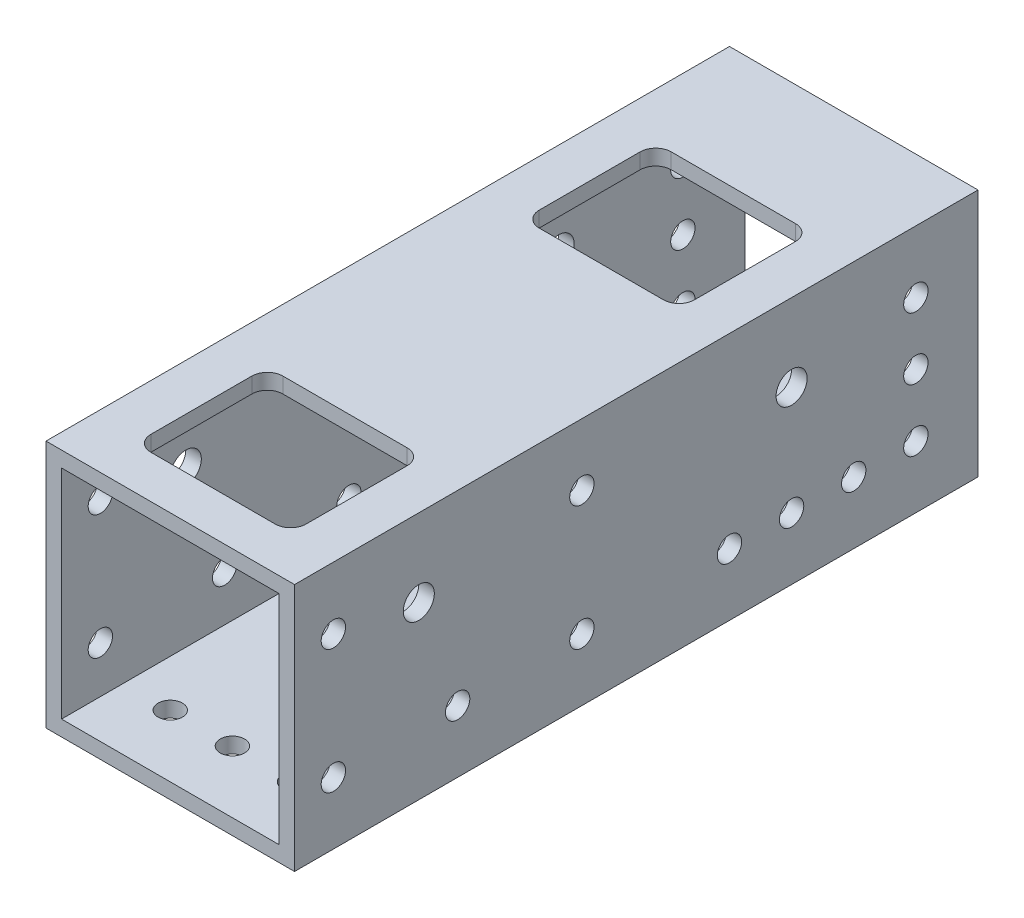
from build123d import *

# Parameters (mm, degrees)
SKETCH1_W               = 50.8
SKETCH1_H               = 50.8
BOSS_EXTRUDE1_DEPTH     = 69.85
SHELL1_T                = -3.175
SKETCH2_W               = 31.75
SKETCH2_H               = 26.9875
CUT_EXTRUDE1_DEPTH      = 79.545162168
FILLET1_R               = 3.175
CUT_EXTRUDE2_DEPTH      = 79.545162168
CUT_EXTRUDE2_DEPTH_BACK = 79.545162168
SKETCH3_R               = 3.175
CUT_EXTRUDE3_DEPTH      = 79.545162168
CUT_EXTRUDE3_DEPTH_BACK = 79.545162168
SKETCH4_R               = 2.4892
CUT_EXTRUDE4_DEPTH      = 79.545162168
CUT_EXTRUDE4_DEPTH_BACK = 79.545162168
SKETCH5_R               = 2.4892
FILLET2_R               = 3.175


with BuildPart() as part:
    # Sketch1 → Boss-Extrude1 (new, symmetric)
    with BuildSketch(Plane.XY):
        Rectangle(SKETCH1_W, SKETCH1_H)
    extrude(amount=BOSS_EXTRUDE1_DEPTH, both=True)

    # Shell1
    shell1_openings = [part.faces().sort_by_distance(p)[0] for p in [
        (0, 0, -69.85),
        (0, 0, 69.85),
    ]]
    offset(amount=SHELL1_T, openings=shell1_openings, kind=Kind.INTERSECTION)

    # Sketch2 → Cut-Extrude1 (cut, through all)
    with BuildSketch(Plane(origin=(0, 0, 0), x_dir=(1, 0, 0), z_dir=(0, 1, 0))):
        with Locations((0, 31.75)):
            Rectangle(SKETCH2_W, SKETCH2_H)
        with Locations((0, -47.625)):
            Rectangle(SKETCH2_W, SKETCH2_H)
    extrude(amount=CUT_EXTRUDE1_DEPTH, mode=Mode.SUBTRACT)

    # Fillet1
    fillet1_edges = [part.edges().sort_by_distance(p)[0] for p in [
        (15.875, 23.8125, -45.24375),
        (-15.875, 23.8125, -45.24375),
        (-15.875, 23.8125, -18.25625),
        (15.875, 23.8125, -18.25625),
    ]]
    fillet(fillet1_edges, radius=FILLET1_R)

    # Sketch3 → Cut-Extrude2 (cut, two sides: drawn at the far end of the back side and taken through both)
    with BuildSketch(Plane(origin=(0, 0, 0), x_dir=(0, 0, -1), z_dir=(1, 0, 0)).offset(-CUT_EXTRUDE2_DEPTH_BACK)):
        with Locations((31.75, 9.525)):
            Circle(SKETCH3_R)
        with Locations((-44.45, 9.525)):
            Circle(SKETCH3_R)
    extrude(amount=CUT_EXTRUDE2_DEPTH + CUT_EXTRUDE2_DEPTH_BACK, mode=Mode.SUBTRACT)

    # Sketch4 → Cut-Extrude3 (cut, two sides: drawn at the far end of the back side and taken through both)
    with BuildSketch(Plane(origin=(0, 0, 0), x_dir=(0, 0, -1), z_dir=(1, 0, 0)).offset(-CUT_EXTRUDE3_DEPTH_BACK)):
        with Locations((57.15, 12.7)):
            Circle(SKETCH4_R)
        with Locations((44.45, -12.7)):
            Circle(SKETCH4_R)
        with Locations((31.75, -12.7)):
            Circle(SKETCH4_R)
        with Locations((19.05, -12.7)):
            Circle(SKETCH4_R)
        with Locations((57.15, 0)):
            Circle(SKETCH4_R)
        with Locations((57.15, -12.7)):
            Circle(SKETCH4_R)
        with Locations((-61.9125, 12.7)):
            Circle(SKETCH4_R)
        with Locations((-11.1125, 12.7)):
            Circle(SKETCH4_R)
        with Locations((-36.5125, -12.7)):
            Circle(SKETCH4_R)
        with Locations((-11.1125, -12.7)):
            Circle(SKETCH4_R)
        with Locations((-61.9125, -12.7)):
            Circle(SKETCH4_R)
    extrude(amount=CUT_EXTRUDE3_DEPTH + CUT_EXTRUDE3_DEPTH_BACK, mode=Mode.SUBTRACT)

    # Sketch5 → Cut-Extrude4 (cut, two sides: drawn at the far end of the back side and taken through both)
    with BuildSketch(Plane(origin=(0, 0, 0), x_dir=(1, 0, 0), z_dir=(0, 1, 0)).offset(-CUT_EXTRUDE4_DEPTH_BACK)):
        with Locations((-12.7, -57.15)):
            Circle(SKETCH5_R)
        with Locations((0, -57.15)):
            Circle(SKETCH5_R)
        with Locations((12.7, -57.15)):
            Circle(SKETCH5_R)
    extrude(amount=CUT_EXTRUDE4_DEPTH + CUT_EXTRUDE4_DEPTH_BACK, mode=Mode.SUBTRACT)

    # Fillet2
    fillet2_edges = [part.edges().sort_by_distance(p)[0] for p in [
        (-15.875, 23.8125, 34.13125),
        (-15.875, 23.8125, 61.11875),
        (15.875, 23.8125, 61.11875),
        (15.875, 23.8125, 34.13125),
    ]]
    fillet(fillet2_edges, radius=FILLET2_R)


solid = part.part
